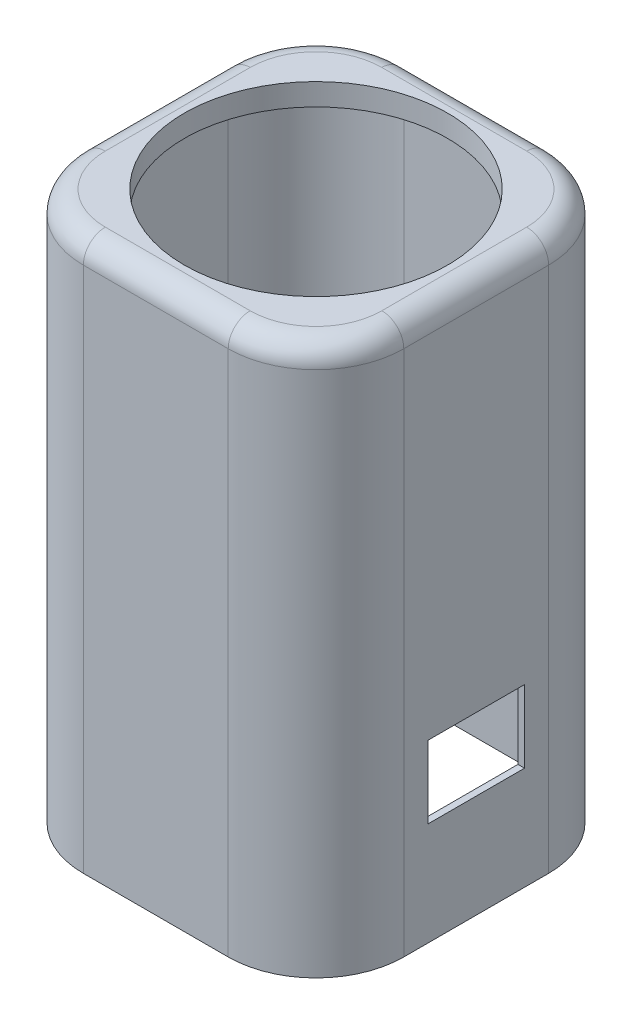
from build123d import *

# Parameters (mm, degrees)
SKETCH5_W           = 146
SKETCH5_H           = 146
BOSS_EXTRUDE2_DEPTH = 250
FILLET8_R           = 40
FILLET9_R           = 40
FILLET10_R          = 40
FILLET11_R          = 40
FILLET12_R          = 10
BOSS_EXTRUDE5_START = -240
BOSS_EXTRUDE5_DEPTH = 240
SKETCH8_R           = 60
CUT_EXTRUDE1_DEPTH  = 34
SKETCH10_W          = 44
SKETCH10_H          = 33
CUT_EXTRUDE2_DEPTH  = 3
CUT_EXTRUDE3_DEPTH  = 3


# Read off the part's stored shape, not the designer's step: Boss-Extrude5
with BuildPart() as part:
    # Sketch5 → Boss-Extrude2 (new body)
    with BuildSketch(Plane(origin=(0, 0, 0), x_dir=(1, 0, 0), z_dir=(0, 1, 0))):
        Rectangle(SKETCH5_W, SKETCH5_H)
    extrude(amount=BOSS_EXTRUDE2_DEPTH)

    # Fillet8
    fillet8_edges = [part.edges().sort_by_distance(p)[0] for p in [
        (73, 125, 73),
    ]]
    fillet(fillet8_edges, radius=FILLET8_R)

    # Fillet9
    fillet9_edges = [part.edges().sort_by_distance(p)[0] for p in [
        (73, 125, -73),
    ]]
    fillet(fillet9_edges, radius=FILLET9_R)

    # Fillet10
    fillet10_edges = [part.edges().sort_by_distance(p)[0] for p in [
        (-73, 125, -73),
    ]]
    fillet(fillet10_edges, radius=FILLET10_R)

    # Fillet11
    fillet11_edges = [part.edges().sort_by_distance(p)[0] for p in [
        (-73, 125, 73),
    ]]
    fillet(fillet11_edges, radius=FILLET11_R)

    # Fillet12
    fillet12_edges = [part.edges().sort_by_distance(p)[0] for p in [
        (73, 250, 0),
        (61.284271247, 250, 61.284271247),
        (0, 250, -73),
        (61.284271247, 250, -61.284271247),
        (-73, 250, 0),
        (-61.284271247, 250, -61.284271247),
        (0, 250, 73),
        (-61.284271247, 250, 61.284271247),
    ]]
    fillet(fillet12_edges, radius=FILLET12_R)

    # Boss-Extrude5 outline → Boss-Extrude5 (cut)
    with BuildSketch(Plane.XZ.offset(BOSS_EXTRUDE5_START)):
        with BuildLine():
            Line((30, 70), (-30, 70))
            ThreePointArc((-30, 70), (-58.284271247, 58.284271247), (-70, 30))
            Line((-70, 30), (-70, -30))
            ThreePointArc((-70, -30), (-58.284271247, -58.284271247), (-30, -70))
            Line((-30, -70), (30, -70))
            ThreePointArc((30, -70), (58.284271247, -58.284271247), (70, -30))
            Line((70, -30), (70, 30))
            ThreePointArc((70, 30), (58.284271247, 58.284271247), (30, 70))
        make_face()
    extrude(amount=BOSS_EXTRUDE5_DEPTH, mode=Mode.SUBTRACT)

    # Sketch8 → Cut-Extrude1 (cut)
    with BuildSketch(Plane(origin=(0, 250, 0), x_dir=(1, 0, 0), z_dir=(0, 1, 0))):
        with Locations(Location((0, 0, 0), (0, 0, 270))):
            Circle(SKETCH8_R)
    extrude(amount=-CUT_EXTRUDE1_DEPTH, mode=Mode.SUBTRACT)

    # Sketch10 → Cut-Extrude2 (cut)
    with BuildSketch(Plane(origin=(73, 0, 0), x_dir=(0, 0, -1), z_dir=(1, 0, 0))):
        with Locations((0, 63.5)):
            Rectangle(SKETCH10_W, SKETCH10_H)
    extrude(amount=-CUT_EXTRUDE2_DEPTH, mode=Mode.SUBTRACT)

    # Sketch11 → Cut-Extrude3 (cut)
    with BuildSketch(Plane.ZY.offset(73)):
        Polygon((0, 0), (-16, 0), (-16, 13), (16, 13), (16, 0), align=None)
    extrude(amount=-CUT_EXTRUDE3_DEPTH, mode=Mode.SUBTRACT)


solid = part.part
